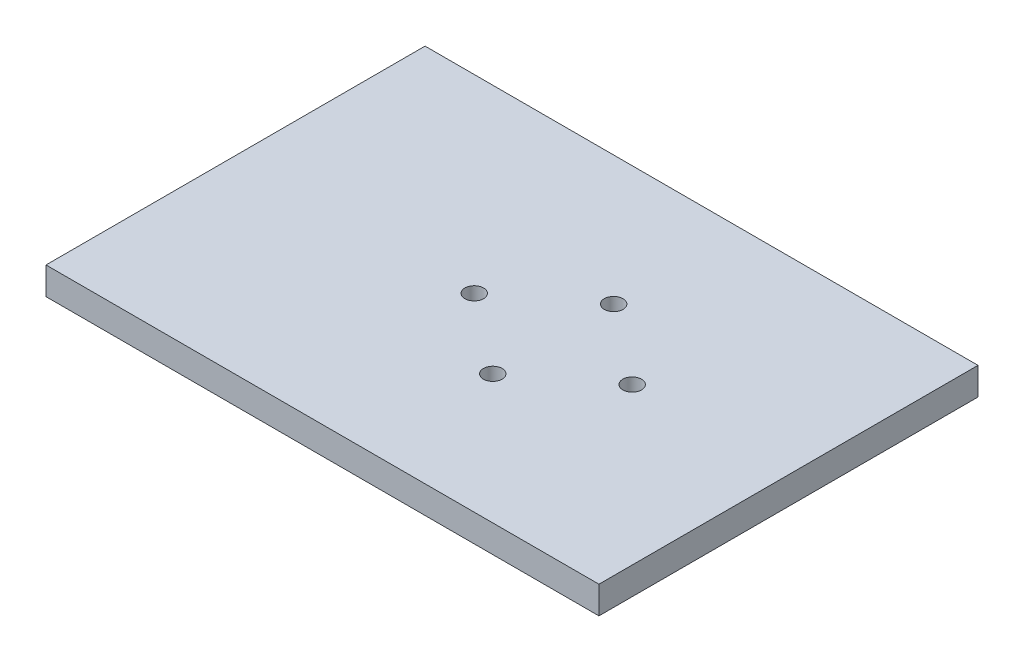
from build123d import *

# Parameters (mm, degrees)
SKETCH1_W           = 100.65
SKETCH1_H           = 69
SKETCH1_R           = 1.7
BOSS_EXTRUDE1_DEPTH = 5


with BuildPart() as part:
    # Sketch1 → Boss-Extrude1 (new body)
    with BuildSketch(Plane(origin=(0, 0, 0), x_dir=(1, 0, 0), z_dir=(0, 1, 0))):
        with Locations((-7.5, 0)):
            Rectangle(SKETCH1_W, SKETCH1_H)
        with Locations((0, 11)):
            Circle(SKETCH1_R, mode=Mode.SUBTRACT)
        with Locations((-14.375, 0)):
            Circle(SKETCH1_R, mode=Mode.SUBTRACT)
        with Locations((0, -11)):
            Circle(SKETCH1_R, mode=Mode.SUBTRACT)
        with Locations((14.375, 0)):
            Circle(SKETCH1_R, mode=Mode.SUBTRACT)
    extrude(amount=BOSS_EXTRUDE1_DEPTH)


solid = part.part
